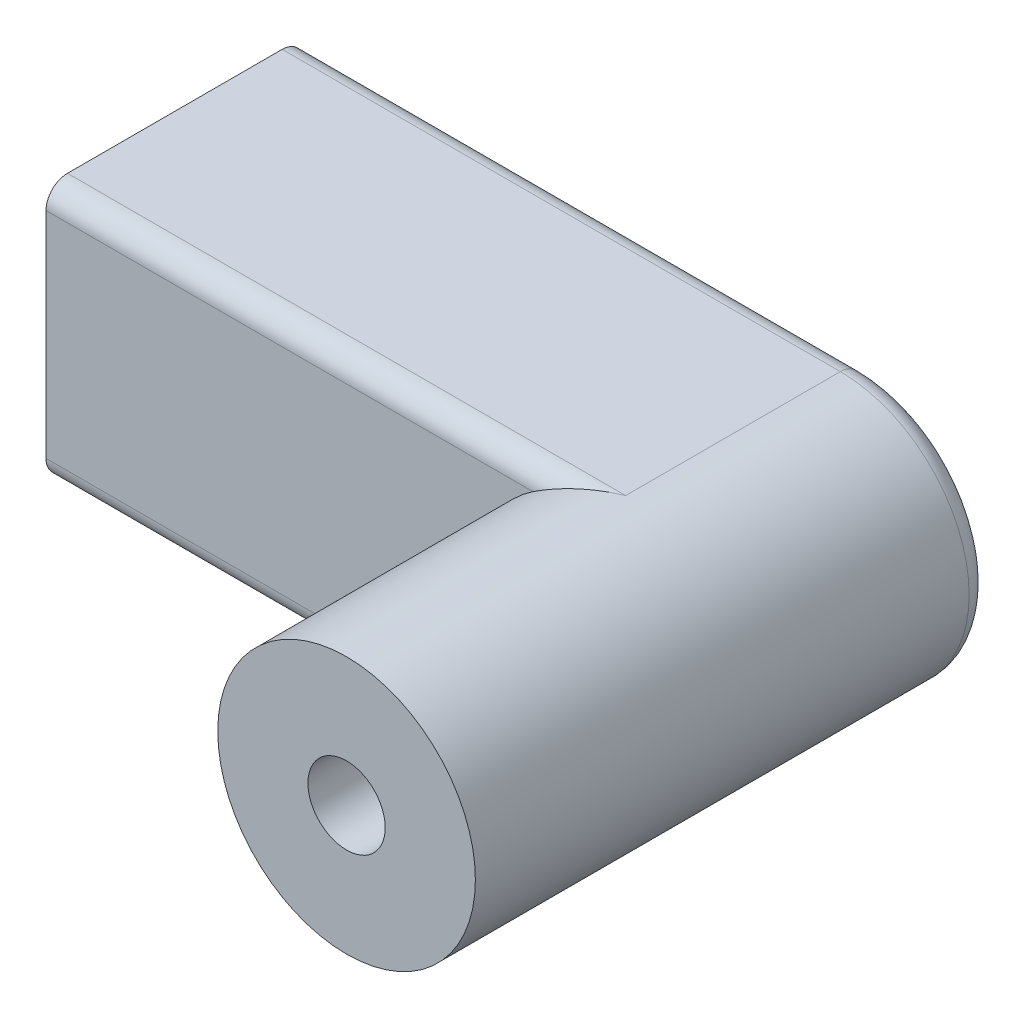
from build123d import *

# Parameters (mm, degrees)
SKETCH3_R             = 3
SKETCH3_R_2           = 0.9
BOSS_EXTRUDE1_DEPTH   = 12
BOSS_EXTRUDE2_DEPTH   = 6
SKETCH5_W             = 3.2
SKETCH5_H             = 3.2
CUT_EXTRUDE1_DEPTH    = 10
FILLET1_R             = 0.5
CHAMFER1_SIZE         = 0.5
BODY_MOVE_COPY1_ANGLE = 90


with BuildPart() as part:
    # Sketch3 → Boss-Extrude1 (new body)
    with BuildSketch(Plane(origin=(0, 0, 0), x_dir=(1, 0, 0), z_dir=(0, 1, 0))):
        with Locations(Location((0, 0, 0), (0, 0, 270))):
            Circle(SKETCH3_R)
        with Locations(Location((0, 0, 0), (0, 0, 270))):
            Circle(SKETCH3_R_2, mode=Mode.SUBTRACT)
    extrude(amount=BOSS_EXTRUDE1_DEPTH)

    # Boss-Extrude2: read off the stored shape, not the designer's step
    # Boss-Extrude2 outline → Boss-Extrude2 (add)
    with BuildSketch(Plane(origin=(0, 0, 0), x_dir=(1, 0, 0), z_dir=(0, 1, 0))):
        with BuildLine():
            Line((-13, -3), (0, -3))
            ThreePointArc((0, -3), (-3, 0), (0, 3))
            Line((0, 3), (-13, 3))
            Line((-13, 3), (-13, -3))
        make_face()
    extrude(amount=BOSS_EXTRUDE2_DEPTH)

    # Sketch5 → Cut-Extrude1 (cut)
    with BuildSketch(Plane.ZY.offset(13)):
        with Locations((0, 3)):
            Rectangle(SKETCH5_W, SKETCH5_H)
    extrude(amount=-CUT_EXTRUDE1_DEPTH, mode=Mode.SUBTRACT)

    # Fillet1
    # the kernel refuses this fillet: 0.5 mm, written as the material it takes off along each edge
    with BuildSketch(Plane(origin=(-14.25, 0, 3), x_dir=(0, 0, -1), z_dir=(1, 0, 0)), Plane(origin=(0, 0, -3), x_dir=(0, 0, 1), z_dir=(-1, 0, 0))) as fillet1_piece_1:
        with BuildLine():
            CenterArc((FILLET1_R, FILLET1_R), FILLET1_R, 180, 90)
            Line((0, FILLET1_R), (0, 0))
            Line((0, 0), (FILLET1_R, 0))
        make_face()
    extrude(amount=14.25, mode=Mode.SUBTRACT)
    with BuildSketch(Plane(origin=(-14.25, 6, 3), x_dir=(0, 0, -1), z_dir=(1, 0, 0))) as fillet1_piece_2_section:
        with BuildLine():
            CenterArc((FILLET1_R, -FILLET1_R), FILLET1_R, 90, 90)
            Line((0, -FILLET1_R), (0, 0))
            Line((0, 0), (FILLET1_R, 0))
        make_face()
    fillet1_piece_2 = extrude(amount=16.375, mode=Mode.PRIVATE)
    fillet1_piece_2 = fillet1_piece_2 - Plane(origin=(0, 6, 0), x_dir=(0, 0, 1), z_dir=(0, -1, 0)) * Cylinder(3, 35, mode=Mode.PRIVATE)
    add(fillet1_piece_2, mode=Mode.SUBTRACT)
    with BuildSketch(Plane(origin=(2.125, 6, -3), x_dir=(0, -1, 0), z_dir=(-1, 0, 0))) as fillet1_piece_3_section:
        with BuildLine():
            CenterArc((FILLET1_R, FILLET1_R), FILLET1_R, 180, 90)
            Line((0, FILLET1_R), (0, 0))
            Line((0, 0), (FILLET1_R, 0))
        make_face()
    fillet1_piece_3 = extrude(amount=16.375, mode=Mode.PRIVATE)
    fillet1_piece_3 = fillet1_piece_3 - Plane(origin=(0, 6, 0), x_dir=(0, 0, 1), z_dir=(0, -1, 0)) * Cylinder(3, 35, mode=Mode.PRIVATE)
    add(fillet1_piece_3, mode=Mode.SUBTRACT)
    with BuildSketch(Plane(origin=(0, 0, 0), x_dir=(0, 0, 1), z_dir=(-1, 0, 0))) as fillet1_piece_4:
        with BuildLine():
            CenterArc((3 - FILLET1_R, FILLET1_R), FILLET1_R, 270, 90)
            Line((3 - FILLET1_R, 0), (3, 0))
            Line((3, 0), (3, FILLET1_R))
        make_face()
    revolve(axis=Axis((0, 0, 0), (0, 1, 0)), revolution_arc=180, mode=Mode.SUBTRACT)

    # Chamfer1
    chamfer1_edges = [part.edges().sort_by_distance(p)[0] for p in [
        (-13, 3, 1.6),
        (-13, 4.6, 0),
        (-13, 3, -1.6),
        (-13, 1.4, 0),
    ]]
    chamfer(chamfer1_edges, length=CHAMFER1_SIZE)


with BuildPart() as part_1:
    # Body-Move/Copy1: read off the stored shape, not the designer's step
    # Body-Move/Copy1: moved
    add(part.part.moved(Location((0, -6, 0))).rotate(Axis((0, 0, 0), (1, 0, 0)), BODY_MOVE_COPY1_ANGLE))


solid = part_1.part
